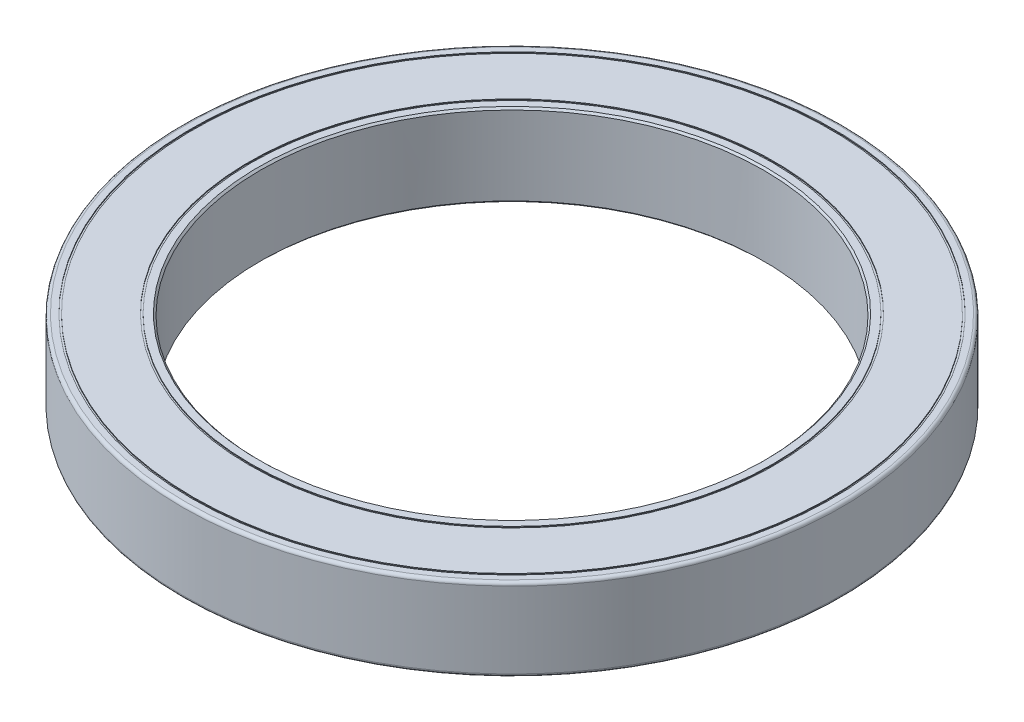
from build123d import *

# Parameters (mm, degrees)
FILLET2_R     = 0.344
CHAMFER2_SIZE = 0.2


with BuildPart() as part:
    # Sketch1 → Revolve1 (revolve)
    with BuildSketch(Plane.XY):
        Polygon((36, 0), (36, 9), (35, 9), (35, 8.9), (34.8, 8.9), (34.8, 9), (28.7, 9), (28.7, 8.9), (28.5, 8.9), (28.5, 9), (27.5, 9), (27.5, 0), (28.5, 0), (28.5, 0.1), (28.7, 0.1), (28.7, 0), (34.8, 0), (34.8, 0.1), (35, 0.1), (35, 0), align=None)
    revolve(axis=Axis((0, 4.5, 0), (0, -1, 0)))

    # Fillet2
    fillet2_edges = [part.edges().sort_by_distance(p)[0] for p in [
        (-36, 0, 0),
        (-36, 9, 0),
    ]]
    fillet(fillet2_edges, radius=FILLET2_R)

    # Chamfer2
    chamfer2_edges = [part.edges().sort_by_distance(p)[0] for p in [
        (-27.5, 0, 0),
        (-27.5, 9, 0),
    ]]
    chamfer(chamfer2_edges, length=CHAMFER2_SIZE)


solid = part.part
